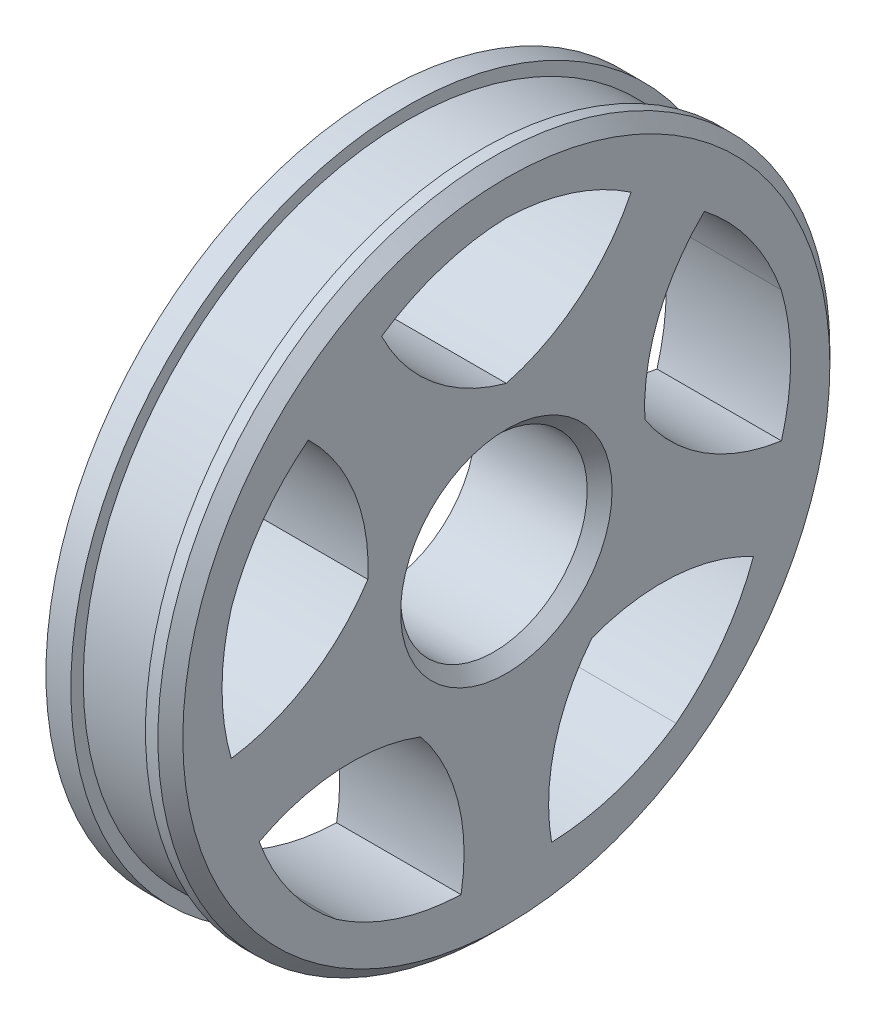
from build123d import *

# Parameters (mm, degrees)
SKETCH1_R           = 13.5
SKETCH1_R_2         = 3.75
BOSS_EXTRUDE1_DEPTH = 2.5
CUT_EXTRUDE1_DEPTH  = 20.254869514
CIRPATTERN1_COUNT   = 5
CHAMFER1_SIZE       = 0.5
SKETCH4_R           = 13.5
SKETCH4_R_2         = 13
CUT_EXTRUDE3_DEPTH  = 1.5


with BuildPart() as part:
    # Sketch1 → Boss-Extrude1 (new, symmetric)
    with BuildSketch(Plane(origin=(0, 0, 0), x_dir=(0, 0, -1), z_dir=(1, 0, 0))):
        Circle(SKETCH1_R)
        Circle(SKETCH1_R_2, mode=Mode.SUBTRACT)
    extrude(amount=BOSS_EXTRUDE1_DEPTH, both=True)

    # Sketch2 → Cut-Extrude1 (cut, symmetric)
    with BuildSketch(Plane(origin=(0, 0, 0), x_dir=(0, 0, -1), z_dir=(1, 0, 0))):
        with BuildLine():
            ThreePointArc((0, 5.849695328), (-2.956289657, 7.377375059), (-5.012219469, 9.99397715))
            ThreePointArc((-5.012219469, 9.99397715), (-2.621563936, 11.159720287), (0, 11.6087119))
            ThreePointArc((0, 11.6087119), (2.621563936, 11.159720287), (5.012219469, 9.99397715))
            ThreePointArc((5.012219469, 9.99397715), (2.956289657, 7.377375059), (0, 5.849695328))
        make_face()
    cut_extrude1 = extrude(amount=CUT_EXTRUDE1_DEPTH, both=True, mode=Mode.SUBTRACT)

    # CirPattern1: Cut-Extrude1 ×5 about axis
    cirpattern1_axis = Axis((2.5, 0, 0), (-1, 0, 0))
    for i in range(1, CIRPATTERN1_COUNT):
        add(cut_extrude1.rotate(cirpattern1_axis, i * 360 / CIRPATTERN1_COUNT), mode=Mode.SUBTRACT)

    # Chamfer1
    chamfer1_edges = [part.edges().sort_by_distance(p)[0] for p in [
        (2.5, 0, 13.5),
        (2.5, 0, 3.75),
    ]]
    chamfer(chamfer1_edges, length=CHAMFER1_SIZE)

    # Sketch4 → Cut-Extrude3 (cut, symmetric)
    with BuildSketch(Plane(origin=(0, 0, 0), x_dir=(0, 0, -1), z_dir=(1, 0, 0))):
        Circle(SKETCH4_R)
        Circle(SKETCH4_R_2, mode=Mode.SUBTRACT)
    extrude(amount=CUT_EXTRUDE3_DEPTH, both=True, mode=Mode.SUBTRACT)


solid = part.part
